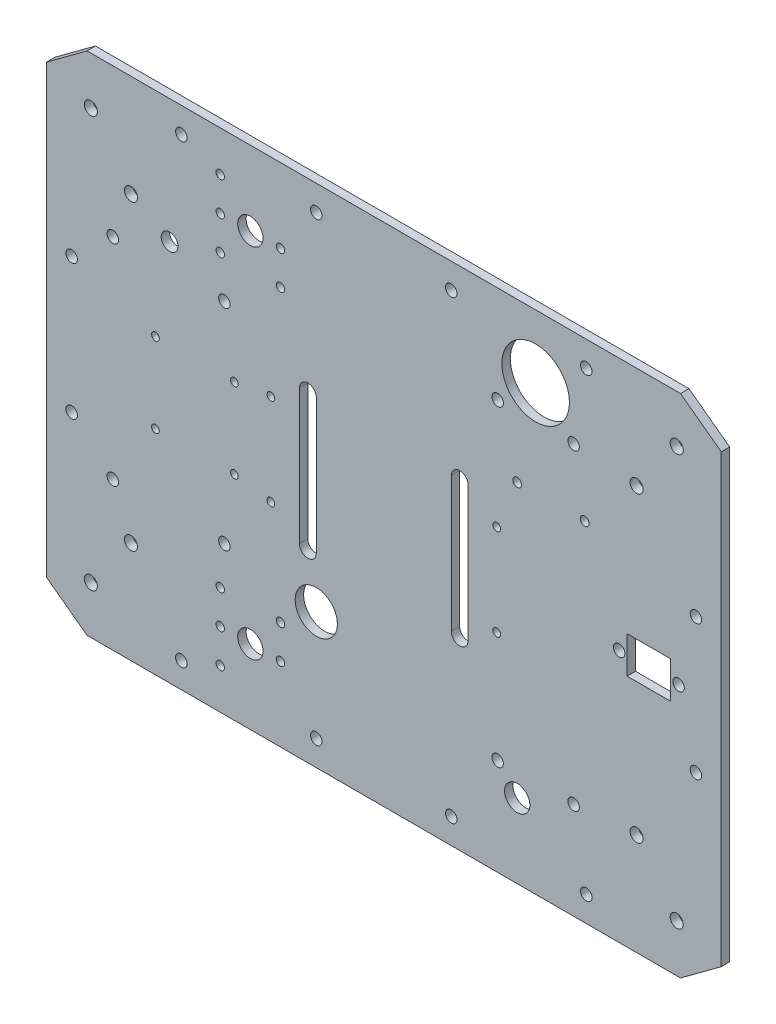
from build123d import *

# Parameters (mm, degrees)
SKETCH1_R                = 2.4638
BOSS_EXTRUDE1_DEPTH      = 3.175
SKETCH2_W                = 16.383
SKETCH2_H                = 13.843
SKETCH2_R                = 2.159
CUT_EXTRUDE1_DEPTH       = 159.781746826
SKETCH5_R                = 12.7
SKETCH5_R_2              = 3.175
SKETCH5_R_3              = 2.159
SKETCH5_R_4              = 1.4478
CUT_EXTRUDE2_DEPTH       = 159.781746826
SKETCH6_R                = 2.159
CUT_EXTRUDE3_DEPTH       = 159.781746826
SKETCH5_3_R              = 1.45415
CUT_EXTRUDE4_DEPTH       = 159.781746826
SKETCH5_4_R              = 1.5875
SKETCH5_4_R_2            = 4.7625
CUT_EXTRUDE5_DEPTH       = 159.781746826
SKETCH5_5_R              = 1.5875
CUT_EXTRUDE6_DEPTH       = 2.54
SKETCH5_6_R              = 1.5875
CUT_EXTRUDE7_DEPTH       = 159.781746826
SKETCH5_7_R              = 1.651
CUT_EXTRUDE8_DEPTH       = 2.54
SKETCH5_9_R              = 1.651
CUT_EXTRUDE9_DEPTH       = 2.54
CUT_EXTRUDE13_DEPTH      = 159.781746826
CUT_EXTRUDE13_DEPTH_BACK = 159.781746826
SKETCH5_12_R             = 1.651
SKETCH5_13_R             = 1.5875
CUT_EXTRUDE14_DEPTH      = 159.781746826
CUT_EXTRUDE15_DEPTH      = 159.781746826
CUT_EXTRUDE15_DEPTH_BACK = 159.781746826
SKETCH9_R                = 7.9375


with BuildPart() as part:
    # Sketch1 → Boss-Extrude1 (new body)
    with BuildSketch(Plane.XY):
        Polygon((-111.686526805, -95.25), (-127, -83.918625912), (-127, 83.918625912), (-111.686526805, 95.25), (111.686526805, 95.25), (127, 83.918625912), (127, -83.918625912), (111.686526805, -95.25), align=None)
        with Locations((-95.147512794, 56.885632681)):
            Circle(SKETCH1_R, mode=Mode.SUBTRACT)
        with Locations((-110.256011578, 77.303596941)):
            Circle(SKETCH1_R, mode=Mode.SUBTRACT)
        with Locations((110.256011578, 77.303596941)):
            Circle(SKETCH1_R, mode=Mode.SUBTRACT)
        with Locations((95.147512794, 56.885632681)):
            Circle(SKETCH1_R, mode=Mode.SUBTRACT)
        with Locations((-110.256011578, -77.303596941)):
            Circle(SKETCH1_R, mode=Mode.SUBTRACT)
        with Locations((-95.147512794, -56.885632681)):
            Circle(SKETCH1_R, mode=Mode.SUBTRACT)
        with Locations((110.256011578, -77.303596941)):
            Circle(SKETCH1_R, mode=Mode.SUBTRACT)
        with Locations((95.147512794, -56.885632681)):
            Circle(SKETCH1_R, mode=Mode.SUBTRACT)
    extrude(amount=BOSS_EXTRUDE1_DEPTH)

    # Sketch2 → Cut-Extrude1 (cut, through all)
    with BuildSketch(Plane.XY.offset(3.175)):
        with Locations((99.772576703, 0)):
            Rectangle(SKETCH2_W, SKETCH2_H)
        with Locations((42.8625, 58.7375)):
            Circle(SKETCH2_R)
        with Locations((42.8625, -58.7375)):
            Circle(SKETCH2_R)
        with Locations((71.4375, -58.7375)):
            Circle(SKETCH2_R)
        with Locations((71.4375, 58.7375)):
            Circle(SKETCH2_R)
        with Locations((110.948576703, 0)):
            Circle(SKETCH2_R)
        with Locations((88.596576703, 0)):
            Circle(SKETCH2_R)
    extrude(amount=-CUT_EXTRUDE1_DEPTH, mode=Mode.SUBTRACT)

    # Sketch5 → Cut-Extrude2 (cut, through all)
    with BuildSketch(Plane(origin=(0, 0, 0), x_dir=(-1, 0, 0), z_dir=(0, 0, -1))):
        with Locations((-57.15, 71.4375)):
            Circle(SKETCH5_R)
        with Locations((80.594630637, 48.58004)):
            Circle(SKETCH5_R_2)
        with Locations((59.995230637, -39.49954)):
            Circle(SKETCH5_R_3)
        with Locations((101.994130637, -39.49954)):
            Circle(SKETCH5_R_3)
        with Locations((101.994130637, 39.49954)):
            Circle(SKETCH5_R_3)
        with Locations((59.995230637, 39.49954)):
            Circle(SKETCH5_R_3)
        with BuildLine():
            Line((-31.75, 25.4), (-31.75, -25.4))
            ThreePointArc((-31.75, -25.4), (-28.575, -28.575), (-25.4, -25.4))
            Line((-25.4, -25.4), (-25.4, 25.4))
            ThreePointArc((-25.4, 25.4), (-28.575, 28.575), (-31.75, 25.4))
        make_face()
        with Locations((85.937708857, 15.03413)):
            Circle(SKETCH5_R_4)
        with Locations((56.219708857, 15.03413)):
            Circle(SKETCH5_R_4)
        with Locations((56.219708857, -15.03413)):
            Circle(SKETCH5_R_4)
        with Locations((85.937708857, -15.03413)):
            Circle(SKETCH5_R_4)
        with BuildLine():
            ThreePointArc((31.75, 25.4), (28.575, 28.575), (25.4, 25.4))
            Line((25.4, 25.4), (25.4, -25.4))
            ThreePointArc((25.4, -25.4), (28.575, -28.575), (31.75, -25.4))
            Line((31.75, -25.4), (31.75, 25.4))
        make_face()
    extrude(amount=-CUT_EXTRUDE2_DEPTH, mode=Mode.SUBTRACT)

    # Sketch6 → Cut-Extrude3 (cut, through all)
    with BuildSketch(Plane(origin=(0, 0, 0), x_dir=(-1, 0, 0), z_dir=(0, 0, -1))):
        with Locations((-76.2, -85.725)):
            Circle(SKETCH6_R)
        with Locations((-25.4, -85.725)):
            Circle(SKETCH6_R)
        with Locations((25.4, -85.725)):
            Circle(SKETCH6_R)
        with Locations((76.2, -85.725)):
            Circle(SKETCH6_R)
        with Locations((76.2, 85.725)):
            Circle(SKETCH6_R)
        with Locations((25.4, 85.725)):
            Circle(SKETCH6_R)
        with Locations((-25.4, 85.725)):
            Circle(SKETCH6_R)
        with Locations((-76.2, 85.725)):
            Circle(SKETCH6_R)
        with Locations((117.475, -25.4)):
            Circle(SKETCH6_R)
        with Locations((117.475, 25.4)):
            Circle(SKETCH6_R)
        with Locations((-117.475, 25.4)):
            Circle(SKETCH6_R)
        with Locations((-117.475, -25.4)):
            Circle(SKETCH6_R)
    extrude(amount=-CUT_EXTRUDE3_DEPTH, mode=Mode.SUBTRACT)

    # Sketch5<3> → Cut-Extrude4 (cut, through all)
    with BuildSketch(Plane(origin=(0, 0, 0), x_dir=(-1, 0, 0), z_dir=(0, 0, -1))):
        with Locations((-42.5, 17.2)):
            Circle(SKETCH5_3_R)
        with Locations((-42.5, -17.2)):
            Circle(SKETCH5_3_R)
        with Locations((42.5, -17.2)):
            Circle(SKETCH5_3_R)
        with Locations((42.5, 17.2)):
            Circle(SKETCH5_3_R)
    extrude(amount=-CUT_EXTRUDE4_DEPTH, mode=Mode.SUBTRACT)

    # Sketch5<4> → Cut-Extrude5 (cut, through all)
    with BuildSketch(Plane(origin=(0, 0, 0), x_dir=(-1, 0, 0), z_dir=(0, 0, -1))):
        with Locations((61.544630637, -54.61)):
            Circle(SKETCH5_4_R)
        with Locations((61.544630637, -67.31)):
            Circle(SKETCH5_4_R)
        with Locations((61.544630637, 54.61)):
            Circle(SKETCH5_4_R)
        with Locations((61.544630637, -80.01)):
            Circle(SKETCH5_4_R)
        with Locations((-50.215369363, -67.31)):
            Circle(SKETCH5_4_R_2)
        with Locations((50.215369363, -67.31)):
            Circle(SKETCH5_4_R_2)
        with Locations((61.544630637, 67.31)):
            Circle(SKETCH5_4_R)
        with Locations((61.544630637, 80.01)):
            Circle(SKETCH5_4_R)
        with Locations((50.215369363, 67.31)):
            Circle(SKETCH5_4_R_2)
    extrude(amount=-CUT_EXTRUDE5_DEPTH, mode=Mode.SUBTRACT)

    # Sketch5<5> → Cut-Extrude6 (cut)
    with BuildSketch(Plane(origin=(0, 0, 0), x_dir=(-1, 0, 0), z_dir=(0, 0, -1))):
        with Locations((38.886108088, 67.31)):
            Circle(SKETCH5_5_R)
        with Locations((38.886108088, 54.61)):
            Circle(SKETCH5_5_R)
        with Locations((38.886108088, -67.31)):
            Circle(SKETCH5_5_R)
    extrude(amount=-CUT_EXTRUDE6_DEPTH, mode=Mode.SUBTRACT)

    # Sketch5<6> → Cut-Extrude7 (cut, through all)
    with BuildSketch(Plane(origin=(0, 0, 0), x_dir=(-1, 0, 0), z_dir=(0, 0, -1))):
        with Locations((38.886108088, 67.31)):
            Circle(SKETCH5_6_R)
        with Locations((38.886108088, 54.61)):
            Circle(SKETCH5_6_R)
        with Locations((38.886108088, -67.31)):
            Circle(SKETCH5_6_R)
    extrude(amount=-CUT_EXTRUDE7_DEPTH, mode=Mode.SUBTRACT)

    # Sketch5<7> → Cut-Extrude8 (cut)
    with BuildSketch(Plane(origin=(0, 0, 0), x_dir=(-1, 0, 0), z_dir=(0, 0, -1))):
        with Locations((-50.215369363, 35.56)):
            Circle(SKETCH5_7_R)
    extrude(amount=-CUT_EXTRUDE8_DEPTH, mode=Mode.SUBTRACT)

    # Sketch5<9> → Cut-Extrude9 (cut)
    with BuildSketch(Plane(origin=(0, 0, 0), x_dir=(-1, 0, 0), z_dir=(0, 0, -1))):
        with Locations((-50.215369363, 35.56)):
            Circle(SKETCH5_9_R)
        with Locations((-75.615369363, 35.627632966)):
            Circle(SKETCH5_9_R)
    extrude(amount=-CUT_EXTRUDE9_DEPTH, mode=Mode.SUBTRACT)

    # Sketch5<12> → Cut-Extrude13 (cut, two sides: drawn at the far end of the back side and taken through both)
    with BuildSketch(Plane(origin=(0, 0, 0), x_dir=(-1, 0, 0), z_dir=(0, 0, -1)).offset(-CUT_EXTRUDE13_DEPTH_BACK)):
        with Locations((-50.215369363, 35.56)):
            Circle(SKETCH5_12_R)
        with Locations((-75.615369363, 35.627632966)):
            Circle(SKETCH5_12_R)
    extrude(amount=CUT_EXTRUDE13_DEPTH + CUT_EXTRUDE13_DEPTH_BACK, mode=Mode.SUBTRACT)

    # Sketch5<13> → Cut-Extrude14 (cut, through all)
    with BuildSketch(Plane(origin=(0, 0, 0), x_dir=(-1, 0, 0), z_dir=(0, 0, -1))):
        with Locations((38.886108088, -54.61)):
            Circle(SKETCH5_13_R)
    extrude(amount=-CUT_EXTRUDE14_DEPTH, mode=Mode.SUBTRACT)

    # Sketch9 → Cut-Extrude15 (cut, two sides: drawn at the far end of the back side and taken through both)
    with BuildSketch(Plane.XY.offset(3.175).offset(-CUT_EXTRUDE15_DEPTH_BACK)):
        with Locations((-25.4, -44.45)):
            Circle(SKETCH9_R)
    extrude(amount=CUT_EXTRUDE15_DEPTH + CUT_EXTRUDE15_DEPTH_BACK, mode=Mode.SUBTRACT)


solid = part.part
